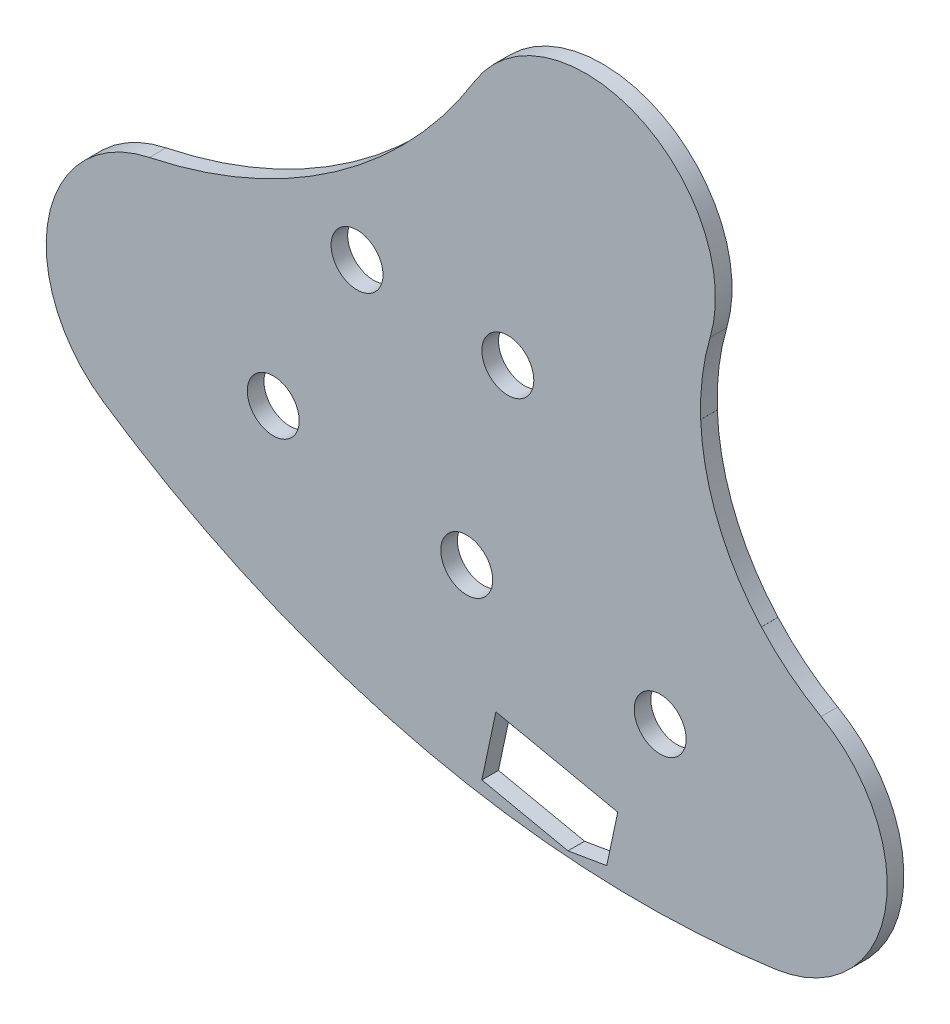
from build123d import *

# Parameters (mm, degrees)
BOSS_EXTRUDE1_DEPTH = 1.6
SKETCH8_3_R         = 2.5
CUT_EXTRUDE1_DEPTH  = 178.756608161
SKETCH25_R          = 2.5
CUT_EXTRUDE2_DEPTH  = 178.756608161
CUT_EXTRUDE3_DEPTH  = 175.275284078


with BuildPart() as part:
    # Sketch8 → Boss-Extrude1 (new body)
    with BuildSketch(Plane.XY):
        with BuildLine():
            ThreePointArc((76.976923111, 65.600382715), (77.137220348, 65.563882378), (77.2977589, 65.528458486))
            ThreePointArc((77.2977589, 65.528458486), (77.354298773, 65.515492739), (77.410522602, 65.501218676))
            ThreePointArc((77.410522602, 65.501218676), (94.023303804, 63.303193357), (110.759742778, 64.144278965))
            ThreePointArc((110.759742778, 64.144278965), (121.287127646, 74.212620667), (115.130462452, 87.414620912))
            ThreePointArc((115.130462452, 87.414620912), (112.067901623, 89.481121015), (109.379631064, 92.015465685))
            ThreePointArc((109.379631064, 92.015465685), (109.377986421, 92.015505684), (109.376341775, 92.015545509))
            ThreePointArc((109.376341775, 92.015545509), (109.37615287, 92.017539878), (109.375963817, 92.019534234))
            ThreePointArc((109.375963817, 92.019534234), (105.194093866, 98.693961054), (103.534911629, 106.393514545))
            ThreePointArc((103.534911629, 106.393514545), (103.533655951, 106.395075463), (103.532400156, 106.396636288))
            ThreePointArc((103.532400156, 106.396636288), (103.533550841, 106.397812032), (103.534701401, 106.398987898))
            ThreePointArc((103.534701401, 106.398987898), (103.693161759, 110.090138371), (104.446158593, 113.707139515))
            ThreePointArc((104.446158593, 113.707139515), (97.535722451, 128.659745128), (81.803110207, 123.779227301))
            ThreePointArc((81.803110207, 123.779227301), (68.396685685, 109.506582784), (50.436082024, 101.705472858))
            ThreePointArc((50.436082024, 101.705472858), (40.732585656, 91.888172428), (45.984244445, 79.122699094))
            ThreePointArc((45.984244445, 79.122699094), (60.856228216, 70.93053968), (76.976923111, 65.600382715))
        make_face()
    extrude(amount=BOSS_EXTRUDE1_DEPTH)

    # Sketch8<3> → Cut-Extrude1 (cut, through all)
    with BuildSketch(Plane.XY):
        with Locations((70.435309654, 103.157249982)):
            Circle(SKETCH8_3_R)
    extrude(amount=CUT_EXTRUDE1_DEPTH, mode=Mode.SUBTRACT)

    # Sketch25 → Cut-Extrude2 (cut, through all)
    with BuildSketch(Plane.XY):
        with Locations((84.959968883, 101.629007764)):
            Circle(SKETCH25_R)
        with Locations((62.365539379, 86.956013681)):
            Circle(SKETCH25_R)
        with Locations((80.999251173, 82.99529597)):
            Circle(SKETCH25_R)
        with Locations((99.632962967, 79.03457826)):
            Circle(SKETCH25_R)
    extrude(amount=CUT_EXTRUDE2_DEPTH, mode=Mode.SUBTRACT)

    # Sketch23 → Cut-Extrude3 (cut, through all)
    with BuildSketch(Plane(origin=(-19.097367964, 26.776820286, 0), x_dir=(0.9781476007338056, -0.2079116908177598, 0), z_dir=(0, 0, 1))):
        Polygon((103.223291241, 65.776224437), (91.223291241, 65.776224437), (91.223291241, 59.276224437), (99.703476733, 59.276224437), (103.223291241, 60.67197249), align=None)
    extrude(amount=CUT_EXTRUDE3_DEPTH, mode=Mode.SUBTRACT)


solid = part.part
